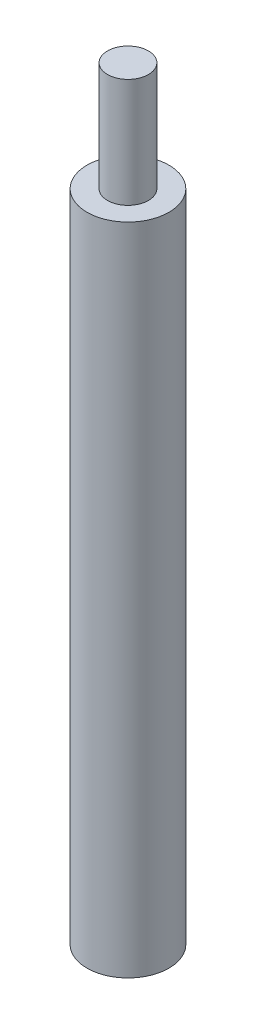
from build123d import *

# Parameters (mm, degrees)
SKETCH1_R           = 2.38125
BOSS_EXTRUDE1_DEPTH = 12.7
SKETCH2_R           = 4.7625
BOSS_EXTRUDE2_DEPTH = 76.2


with BuildPart() as part:
    # Sketch1 → Boss-Extrude1 (new body)
    with BuildSketch(Plane(origin=(0, 0, 0), x_dir=(1, 0, 0), z_dir=(0, 1, 0))):
        Circle(SKETCH1_R)
    extrude(amount=-BOSS_EXTRUDE1_DEPTH)

    # Sketch2 → Boss-Extrude2 (add)
    with BuildSketch(Plane(origin=(0, -12.7, 0), x_dir=(-1, 0, 0), z_dir=(0, -1, 0))):
        Circle(SKETCH2_R)
    extrude(amount=BOSS_EXTRUDE2_DEPTH)


solid = part.part
